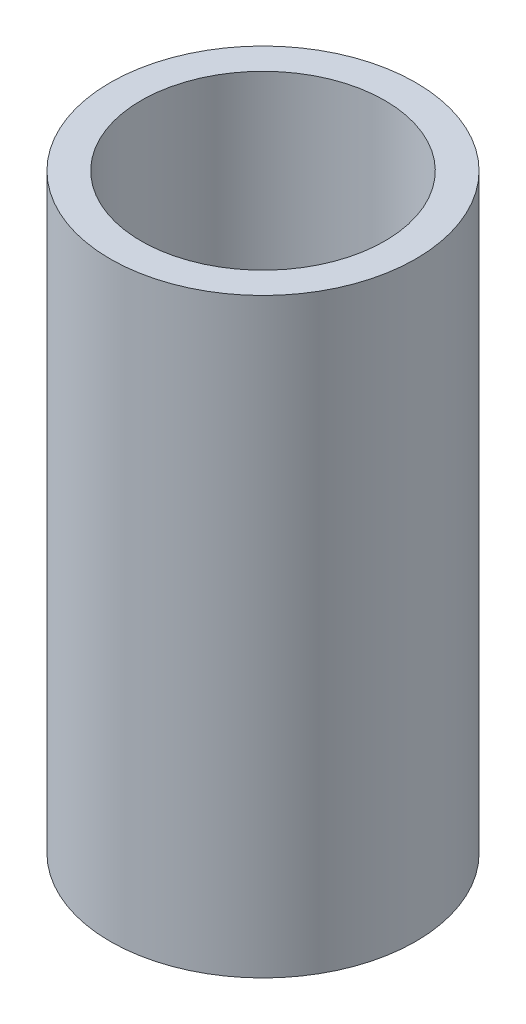
from build123d import *

# Parameters (mm, degrees)
SKETCH1_R           = 27.5
BOSS_EXTRUDE1_DEPTH = 106.386436571
SKETCH2_R           = 21.929450723
CUT_EXTRUDE1_DEPTH  = 114.272123165


with BuildPart() as part:
    # Sketch1 → Boss-Extrude1 (new body)
    with BuildSketch(Plane(origin=(0, 0, 0), x_dir=(1, 0, 0), z_dir=(0, 1, 0))):
        Circle(SKETCH1_R)
    extrude(amount=BOSS_EXTRUDE1_DEPTH)

    # Sketch2 → Cut-Extrude1 (cut, through all)
    with BuildSketch(Plane(origin=(0, 0, 0), x_dir=(1, 0, 0), z_dir=(0, 1, 0))):
        Circle(SKETCH2_R)
    extrude(amount=CUT_EXTRUDE1_DEPTH, mode=Mode.SUBTRACT)


solid = part.part
